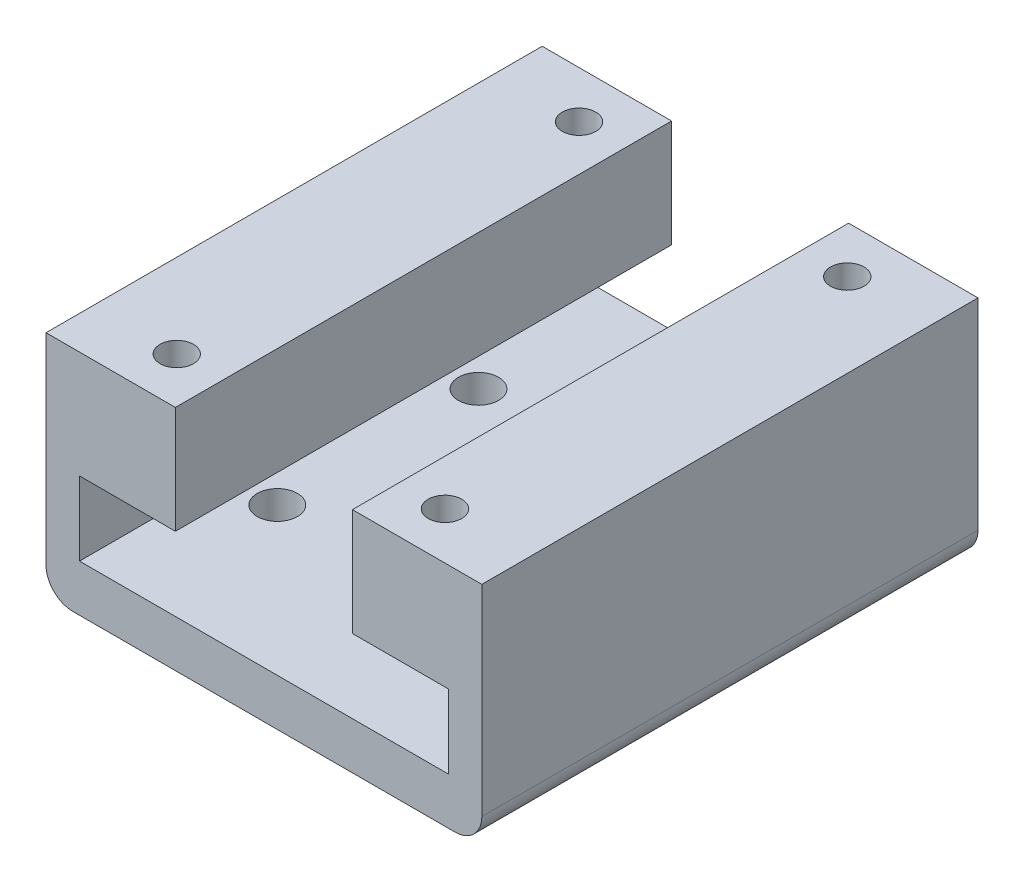
from build123d import *

# Parameters (mm, degrees)
SKETCH_1_W          = 32.5
SKETCH_1_H          = 37
EXTRUDE_1_DEPTH     = 17
CUT_EXTRUDE_2_DEPTH = 45
CUT_EXTRUDE_3_REACH = 31.922
SKETCH_4_R          = 1.5
SKETCH_5_R          = 1.25
CUT_EXTRUDE_4_DEPTH = 2
FILLET_1_R          = 2


with BuildPart() as part:
    # 草图1 → 凸台-拉伸1 (new body)
    with BuildSketch(Plane(origin=(0, 0, 0), x_dir=(1, 0, 0), z_dir=(0, 1, 0))):
        Rectangle(SKETCH_1_W, SKETCH_1_H)
    extrude(amount=EXTRUDE_1_DEPTH)

    # 草图2 → 切除-拉伸2 (cut)
    with BuildSketch(Plane(origin=(0, 0, -18.5), x_dir=(-1, 0, 0), z_dir=(0, 0, -1))):
        Polygon((-6.6, 17), (-6.6, 9), (-13.75, 9), (-13.75, 3.5), (13.75, 3.5), (13.75, 9), (6.6, 9), (6.6, 17), align=None)
    extrude(amount=-CUT_EXTRUDE_2_DEPTH, mode=Mode.SUBTRACT)

    # 草图4 → 切除-拉伸3 (cut, up to next)
    with BuildSketch(Plane.XZ, mode=Mode.PRIVATE) as cut_extrude_3_sk1:
        with Locations((-10, 7.5)):
            Circle(SKETCH_4_R)
    cut_extrude_3_tool1 = extrude(cut_extrude_3_sk1.sketch, amount=-CUT_EXTRUDE_3_REACH, mode=Mode.PRIVATE) & part.part
    # 草图4 → 切除-拉伸3 (cut, up to next)
    with BuildSketch(Plane.XZ, mode=Mode.PRIVATE) as cut_extrude_3_sk2:
        with Locations((10, 7.5)):
            Circle(SKETCH_4_R)
    cut_extrude_3_tool2 = extrude(cut_extrude_3_sk2.sketch, amount=-CUT_EXTRUDE_3_REACH, mode=Mode.PRIVATE) & part.part
    # 草图4 → 切除-拉伸3 (cut, up to next)
    with BuildSketch(Plane.XZ, mode=Mode.PRIVATE) as cut_extrude_3_sk3:
        with Locations((10, -7.5)):
            Circle(SKETCH_4_R)
    cut_extrude_3_tool3 = extrude(cut_extrude_3_sk3.sketch, amount=-CUT_EXTRUDE_3_REACH, mode=Mode.PRIVATE) & part.part
    # 草图4 → 切除-拉伸3 (cut, up to next)
    with BuildSketch(Plane.XZ, mode=Mode.PRIVATE) as cut_extrude_3_sk4:
        with Locations((-10, -7.5)):
            Circle(SKETCH_4_R)
    cut_extrude_3_tool4 = extrude(cut_extrude_3_sk4.sketch, amount=-CUT_EXTRUDE_3_REACH, mode=Mode.PRIVATE) & part.part
    add(cut_extrude_3_tool1.solids().sort_by_distance((-10, 0, 7.5))[0], mode=Mode.SUBTRACT)
    add(cut_extrude_3_tool2.solids().sort_by_distance((10, 0, 7.5))[0], mode=Mode.SUBTRACT)
    add(cut_extrude_3_tool3.solids().sort_by_distance((10, 0, -7.5))[0], mode=Mode.SUBTRACT)
    add(cut_extrude_3_tool4.solids().sort_by_distance((-10, 0, -7.5))[0], mode=Mode.SUBTRACT)

    # 草图5 → 切除-拉伸4 (cut)
    with BuildSketch(Plane(origin=(0, 17, 0), x_dir=(1, 0, 0), z_dir=(0, 1, 0))):
        with Locations((-10, 15)):
            Circle(SKETCH_5_R)
        with Locations((10, 15)):
            Circle(SKETCH_5_R)
        with Locations((10, -15)):
            Circle(SKETCH_5_R)
        with Locations((-10, -15)):
            Circle(SKETCH_5_R)
    extrude(amount=-CUT_EXTRUDE_4_DEPTH, mode=Mode.SUBTRACT)

    # 圆角1
    fillet_1_edges = [part.edges().sort_by_distance(p)[0] for p in [
        (16.25, 0, 0),
        (-16.25, 0, 0),
    ]]
    fillet(fillet_1_edges, radius=FILLET_1_R)


solid = part.part
